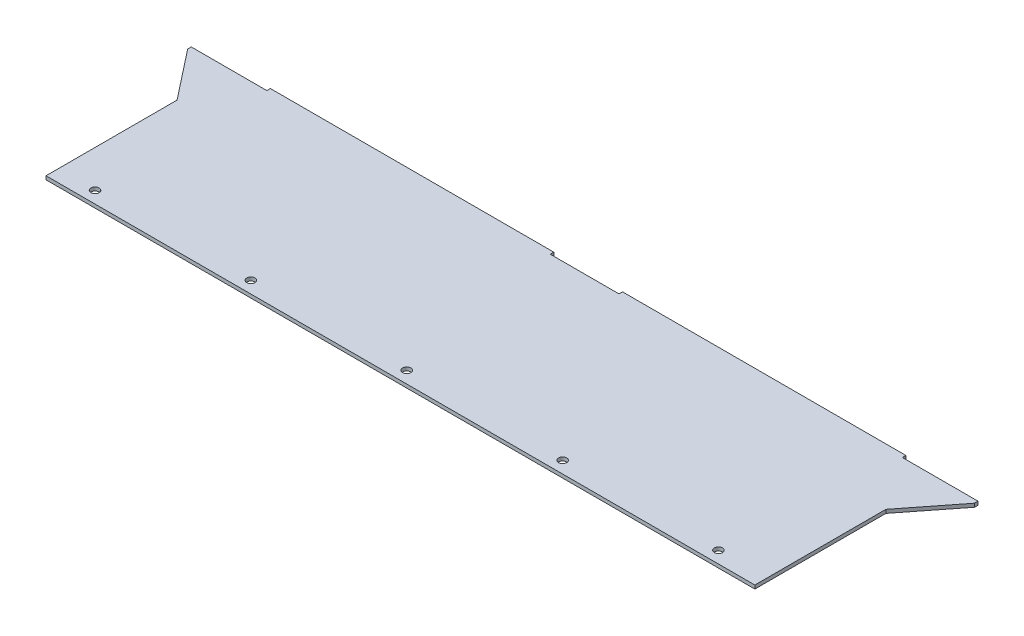
from build123d import *

# Parameters (mm, degrees)
SKETCH1_W           = 635.3556
SKETCH1_H           = 165.1
BOSS_EXTRUDE1_DEPTH = 1.5875
SKETCH2_W           = 254
SKETCH2_H           = 3.175
BOSS_EXTRUDE2_DEPTH = 3.175
BOSS_EXTRUDE3_DEPTH = 3.175
SKETCH4_R           = 3.675
CUT_EXTRUDE1_DEPTH  = 363.887848815
LPATTERN1_COUNT     = 5
LPATTERN1_PITCH     = 139.7


with BuildPart() as part:
    # Sketch1 → Boss-Extrude1 (new, symmetric)
    with BuildSketch(Plane(origin=(0, 0, 0), x_dir=(1, 0, 0), z_dir=(0, 1, 0))):
        Rectangle(SKETCH1_W, SKETCH1_H)
    extrude(amount=BOSS_EXTRUDE1_DEPTH, both=True)

    # Sketch2 → Boss-Extrude2 (add)
    with BuildSketch(Plane(origin=(0, 0, -82.55), x_dir=(-1, 0, 0), z_dir=(0, 0, -1))):
        with Locations((-157.8229, 0)):
            Rectangle(SKETCH2_W, SKETCH2_H)
        with Locations((157.8229, 0)):
            Rectangle(SKETCH2_W, SKETCH2_H)
    extrude(amount=BOSS_EXTRUDE2_DEPTH)

    # Sketch3 → Boss-Extrude3 (add)
    with BuildSketch(Plane.XZ.offset(1.5875)):
        Polygon((317.6778, -82.55), (352.6028, -82.55), (352.6028, -79.375), (317.6778, -34.925), align=None)
    boss_extrude3 = extrude(amount=-BOSS_EXTRUDE3_DEPTH)

    # Mirror1: Boss-Extrude3 across plane
    add(boss_extrude3.mirror(Plane(origin=(0, 0, 0), x_dir=(0, 0, 1), z_dir=(1, 0, 0))))

    # Sketch4 → Cut-Extrude1 (cut, through all)
    with BuildSketch(Plane.XZ.offset(1.5875)):
        with Locations((-284.4038, 71.882)):
            Circle(SKETCH4_R)
    cut_extrude1 = extrude(amount=-CUT_EXTRUDE1_DEPTH, mode=Mode.SUBTRACT)

    # LPattern1: Cut-Extrude1 ×5
    with Locations(*[(i * LPATTERN1_PITCH, 0, 0) for i in range(1, LPATTERN1_COUNT)]):
        add(cut_extrude1, mode=Mode.SUBTRACT)


solid = part.part
